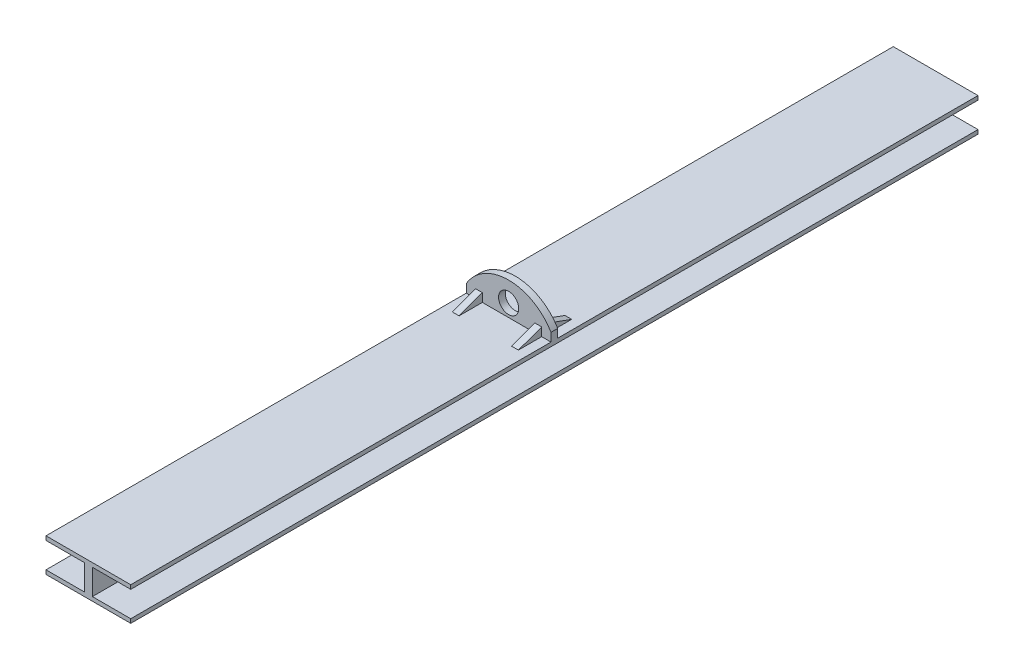
from build123d import *

# Parameters (mm, degrees)
SALIENTE_EXTRUIR1_DEPTH   = 500
SALIENTE_EXTRUIR2_DEPTH   = 3.96875
CROQUIS4_R                = 11.90625
CORTAR_EXTRUIR1_DEPTH     = 7.9375
NERVIO6_REACH             = 512.501
CROQUIS6_WALL_W           = 1052.239133926
CROQUIS6_WALL_H           = 7.9375
SIMETR_A2_COPY_1_REACH    = 512.501
SIMETR_A2_COPY_1_SKETCH_W = 1052.239133926
SIMETR_A2_COPY_1_SKETCH_H = 7.9375


with BuildPart() as part:
    # Croquis1 → Saliente-Extruir1 (new, symmetric)
    with BuildSketch(Plane.XY):
        Polygon((-4.7625, 15), (-4.7625, -15), (-50, -15), (-50, -19.7625), (50, -19.7625), (50, -15), (4.7625, -15), (4.7625, 15), (50, 15), (50, 19.7625), (-50, 19.7625), (-50, 15), align=None)
    extrude(amount=SALIENTE_EXTRUIR1_DEPTH, both=True)

    # Croquis3 → Saliente-Extruir2 (add, symmetric)
    with BuildSketch(Plane.XY):
        with BuildLine():
            Line((-50, 19.7625), (50, 19.7625))
            Line((50, 19.7625), (50, 29.7625))
            ThreePointArc((50, 29.7625), (0, 58.187682599), (-50, 29.7625))
            Line((-50, 29.7625), (-50, 19.7625))
        make_face()
    extrude(amount=SALIENTE_EXTRUIR2_DEPTH, both=True)

    # Croquis4 → Cortar-Extruir1 (cut)
    with BuildSketch(Plane.XY.offset(3.96875)):
        with Locations((0, 34.7625)):
            Circle(CROQUIS4_R)
    extrude(amount=-CORTAR_EXTRUIR1_DEPTH, mode=Mode.SUBTRACT)

    # Croquis6 wall → Nervio6 (add, up to next)
    with BuildSketch(Plane(origin=(35, 24.7625, 17.706137097), x_dir=(0, -0.342020143321, 0.939692620788), z_dir=(0, -0.939692620788, -0.342020143321)), mode=Mode.PRIVATE) as nervio6_sk1:
        Rectangle(CROQUIS6_WALL_W, CROQUIS6_WALL_H)
    nervio6_tool1 = extrude(nervio6_sk1.sketch, amount=NERVIO6_REACH, mode=Mode.PRIVATE) - part.part
    nervio6 = nervio6_tool1.solids().sort_by_distance((35, 24.7625, 17.706137097))[0]
    add(nervio6)

    # Simetría1: Nervio6 across plane
    add(nervio6.mirror(Plane.XY))

    # Simetría2: Nervio6 across plane
    add(nervio6.mirror(Plane(origin=(0, 0, 0), x_dir=(0, 0, 1), z_dir=(1, 0, 0))))

    # Simetría2 copy 1 sketch → Simetría2 copy 1 (add, up to next)
    with BuildSketch(Plane(origin=(-35, 24.7625, -17.706137097), x_dir=(0, -0.342020143321, -0.939692620788), z_dir=(0, -0.939692620788, 0.342020143321)), mode=Mode.PRIVATE) as simetr_a2_copy_1_sk1:
        Rectangle(SIMETR_A2_COPY_1_SKETCH_W, SIMETR_A2_COPY_1_SKETCH_H)
    simetr_a2_copy_1_tool1 = extrude(simetr_a2_copy_1_sk1.sketch, amount=SIMETR_A2_COPY_1_REACH, mode=Mode.PRIVATE) - part.part
    add(simetr_a2_copy_1_tool1.solids().sort_by_distance((-35, 24.7625, -17.706137097))[0])


solid = part.part
